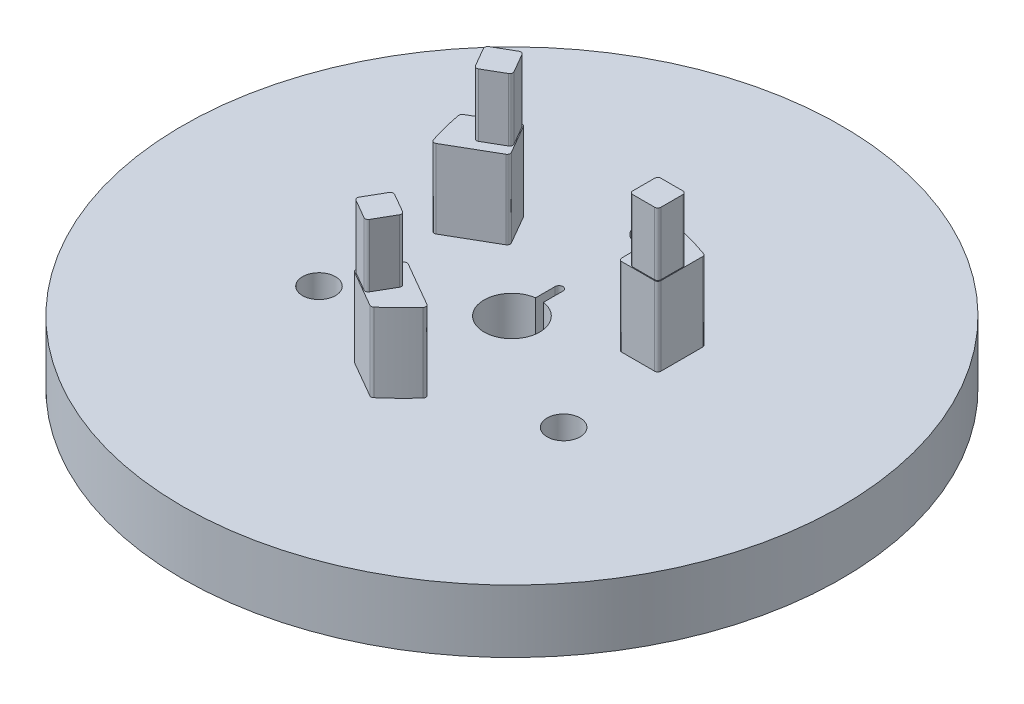
from build123d import *

# Parameters (mm, degrees)
BOSS_EXTRUDE1_OUTLINE_R   = 42
BOSS_EXTRUDE1_OUTLINE_R_2 = 2.1
BOSS_EXTRUDE1_OUTLINE_R_3 = 3.55
BOSS_EXTRUDE1_DEPTH       = 8
CUT_EXTRUDE2_DEPTH        = 10
BOSS_EXTRUDE5_DEPTH       = 10
SKETCH9_W                 = 3.6
SKETCH9_H                 = 3.6
BOSS_EXTRUDE6_DEPTH       = 8
FILLET1_R                 = 0.4


# Read off the part's stored shape, not the designer's step: Boss-Extrude1
with BuildPart() as part:
    # Boss-Extrude1 outline → Boss-Extrude1 (new body)
    with BuildSketch(Plane(origin=(0, 0, 0), x_dir=(1, 0, 0), z_dir=(0, 1, 0))):
        Circle(BOSS_EXTRUDE1_OUTLINE_R)
        with Locations((-15.588457268, -9)):
            Circle(BOSS_EXTRUDE1_OUTLINE_R_2, mode=Mode.SUBTRACT)
        with Locations((15.588457268, -9)):
            Circle(BOSS_EXTRUDE1_OUTLINE_R_2, mode=Mode.SUBTRACT)
        Circle(BOSS_EXTRUDE1_OUTLINE_R_3, mode=Mode.SUBTRACT)
        with Locations((0, 18)):
            Circle(BOSS_EXTRUDE1_OUTLINE_R_2, mode=Mode.SUBTRACT)
    extrude(amount=BOSS_EXTRUDE1_DEPTH)

    # Sketch3 → Cut-Extrude2 (cut)
    with BuildSketch(Plane(origin=(0, 8, 0), x_dir=(1, 0, 0), z_dir=(0, 1, 0))):
        with BuildLine():
            Line((0.5, 6), (0.5, 0))
            ThreePointArc((0.5, 0), (0, -0.5), (-0.5, 0))
            Line((-0.5, 0), (-0.5, 6))
            ThreePointArc((-0.5, 6), (0, 6.5), (0.5, 6))
        make_face()
    extrude(amount=-CUT_EXTRUDE2_DEPTH, mode=Mode.SUBTRACT)

    # Sketch7 → Boss-Extrude5 (add)
    with BuildSketch(Plane(origin=(0, 8, 0), x_dir=(1, 0, 0), z_dir=(0, 1, 0))):
        with BuildLine():
            Line((-5.196152423, -15), (0, -18))
            ThreePointArc((0, -18), (1.923015451, -16.253248712), (3.712435565, -14.369872981))
            Line((3.712435565, -14.369872981), (-2.696152423, -10.669872981))
            Line((-2.696152423, -10.669872981), (-5.196152423, -15))
        make_face()
        with BuildLine():
            Line((-10.392304845, 12), (-15.588457268, 9))
            ThreePointArc((-15.588457268, 9), (-15.037234004, 6.461244123), (-14.300892833, 3.969872981))
            Line((-14.300892833, 3.969872981), (-7.892304845, 7.669872981))
            Line((-7.892304845, 7.669872981), (-10.392304845, 12))
        make_face()
        with BuildLine():
            Line((15.588457268, 3), (15.588457268, 9))
            ThreePointArc((15.588457268, 9), (13.114218553, 9.792004588), (10.588457268, 10.4))
            Line((10.588457268, 10.4), (10.588457268, 3))
            Line((10.588457268, 3), (15.588457268, 3))
        make_face()
    extrude(amount=BOSS_EXTRUDE5_DEPTH)

    # Sketch9 → Boss-Extrude6 (add)
    with BuildSketch(Plane(origin=(0, 18, 0), x_dir=(1, 0, 0), z_dir=(0, 1, 0))):
        with Locations((13.688457268, 4.9)):
            Rectangle(SKETCH9_W, SKETCH9_H)
        Polygon((-0.141858429, -13.645706006), (-3.259549882, -11.845706006), (-5.059549882, -14.96339746), (-1.941858429, -16.76339746), align=None)
        Polygon((-11.746598839, 6.945706006), (-8.628907386, 8.745706006), (-10.428907386, 11.86339746), (-13.546598839, 10.06339746), align=None)
    extrude(amount=BOSS_EXTRUDE6_DEPTH)

    # Fillet1
    fillet1_edges = [part.edges().sort_by_distance(p)[0] for p in [
        (-13.546598839, 22, -10.06339746),
        (-11.746598839, 22, -6.945706006),
        (-8.628907386, 22, -8.745706006),
        (-10.428907386, 22, -11.86339746),
        (-7.892304845, 13, -7.669872981),
        (-10.392304845, 13, -12),
        (-15.588457268, 13, -9),
        (-14.300892833, 13, -3.969872981),
        (-2.696152423, 13, 10.669872981),
        (-5.196152423, 13, 15),
        (0, 13, 18),
        (3.712435565, 13, 14.369872981),
        (10.588457268, 13, -3),
        (15.588457268, 13, -3),
        (15.588457268, 13, -9),
        (10.588457268, 13, -10.4),
        (15.488457268, 22, -6.7),
        (11.888457268, 22, -6.7),
        (11.888457268, 22, -3.1),
        (15.488457268, 22, -3.1),
        (-1.941858429, 22, 16.76339746),
        (-0.141858429, 22, 13.645706006),
        (-3.259549882, 22, 11.845706006),
        (-5.059549882, 22, 14.96339746),
    ]]
    fillet(fillet1_edges, radius=FILLET1_R)


solid = part.part
